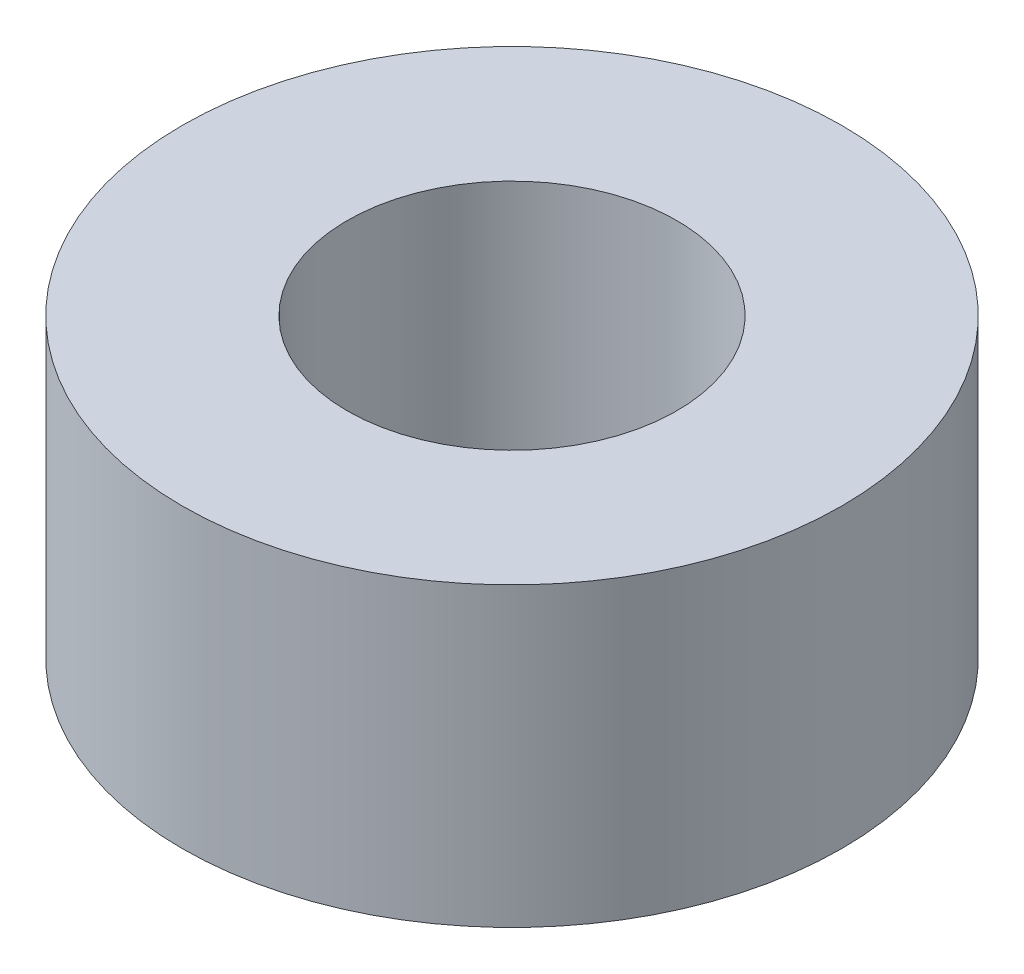
from build123d import *

# Parameters (mm, degrees)
SKETCH1_R           = 10
SKETCH1_R_2         = 5
BOSS_EXTRUDE1_DEPTH = 9


with BuildPart() as part:
    # Sketch1 → Boss-Extrude1 (new body)
    with BuildSketch(Plane(origin=(0, 0, 0), x_dir=(1, 0, 0), z_dir=(0, 1, 0))):
        Circle(SKETCH1_R)
        Circle(SKETCH1_R_2, mode=Mode.SUBTRACT)
    extrude(amount=BOSS_EXTRUDE1_DEPTH)


solid = part.part
